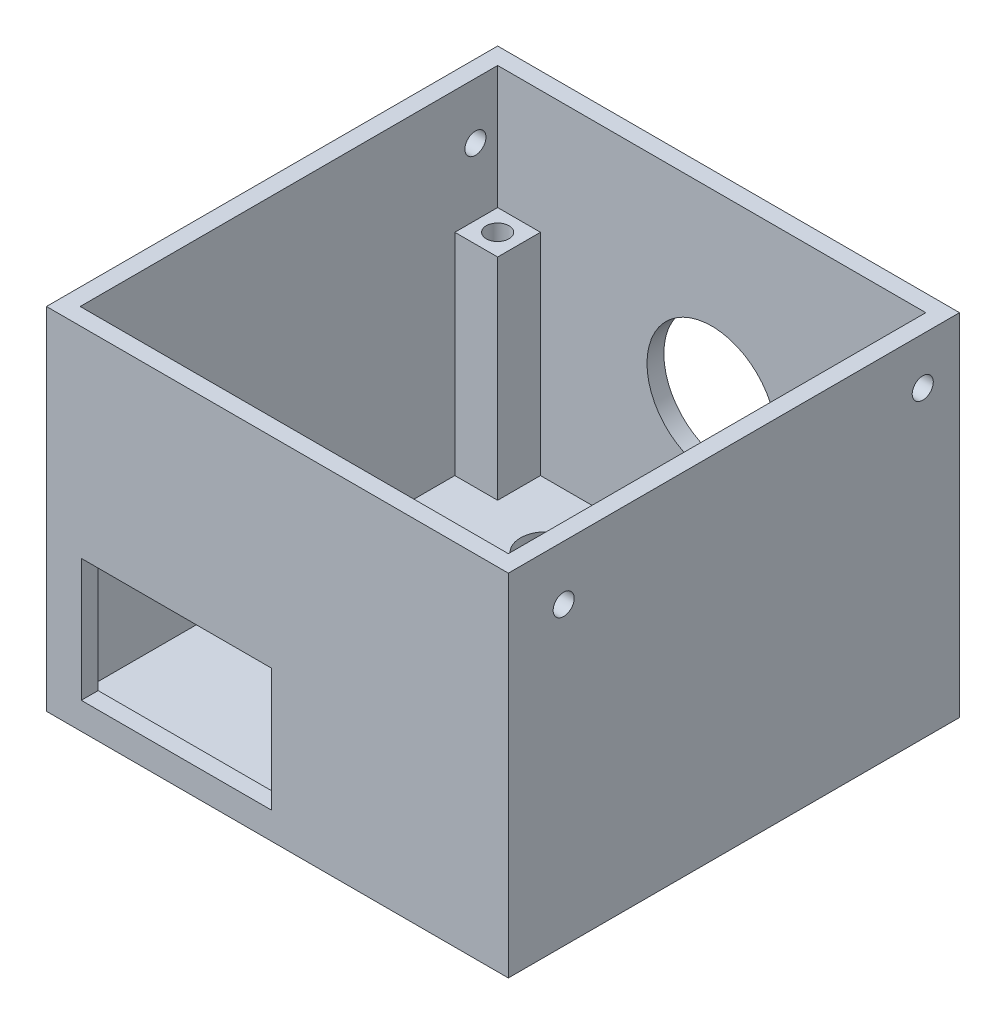
from build123d import *

# Parameters (mm, degrees)
SKETCH1_W           = 54.8
SKETCH1_H           = 53.53
BOSS_EXTRUDE1_DEPTH = 41.6
SKETCH2_W           = 50.8
SKETCH2_H           = 49.53
CUT_EXTRUDE1_DEPTH  = 39.6
SKETCH3_W           = 5.08
SKETCH3_H           = 5.08
BOSS_EXTRUDE2_DEPTH = 25
SKETCH4_R           = 1.35
CUT_EXTRUDE2_DEPTH  = 10
CUT_EXTRUDE3_REACH  = 58.548
SKETCH5_R           = 3
CUT_EXTRUDE4_REACH  = 58.548
SKETCH6_R           = 2
CUT_EXTRUDE5_REACH  = 58.548
SKETCH7_R           = 2
CUT_EXTRUDE6_REACH  = 75.824
SKETCH8_R           = 1.25
CUT_EXTRUDE7_REACH  = 75.824
SKETCH10_R          = 1.25
CUT_EXTRUDE8_REACH  = 75.122
SKETCH12_R          = 7.680495542
CUT_EXTRUDE9_REACH  = 75.122
SKETCH13_W          = 22.581735489
SKETCH13_H          = 14.589690318
CUT_EXTRUDE10_REACH = 75.824
SKETCH14_R          = 1.25


with BuildPart() as part:
    # Sketch1 → Boss-Extrude1 (new body)
    with BuildSketch(Plane(origin=(0, 0, 0), x_dir=(1, 0, 0), z_dir=(0, 1, 0))):
        Rectangle(SKETCH1_W, SKETCH1_H)
    extrude(amount=BOSS_EXTRUDE1_DEPTH)

    # Sketch2 → Cut-Extrude1 (cut)
    with BuildSketch(Plane(origin=(0, 41.6, 0), x_dir=(1, 0, 0), z_dir=(0, 1, 0))):
        Rectangle(SKETCH2_W, SKETCH2_H)
    extrude(amount=-CUT_EXTRUDE1_DEPTH, mode=Mode.SUBTRACT)

    # Sketch3 → Boss-Extrude2 (add)
    with BuildSketch(Plane(origin=(0, 2, 0), x_dir=(1, 0, 0), z_dir=(0, 1, 0))):
        with Locations((-22.86, 22.225)):
            Rectangle(SKETCH3_W, SKETCH3_H)
        with Locations((22.86, 22.225)):
            Rectangle(SKETCH3_W, SKETCH3_H)
        with Locations((22.86, -22.225)):
            Rectangle(SKETCH3_W, SKETCH3_H)
    extrude(amount=BOSS_EXTRUDE2_DEPTH)

    # Sketch4 → Cut-Extrude2 (cut)
    with BuildSketch(Plane(origin=(0, 27, 0), x_dir=(1, 0, 0), z_dir=(0, 1, 0))):
        with Locations((-22.86, 22.225)):
            Circle(SKETCH4_R)
        with Locations((22.86, 22.225)):
            Circle(SKETCH4_R)
        with Locations((22.86, -22.225)):
            Circle(SKETCH4_R)
    extrude(amount=-CUT_EXTRUDE2_DEPTH, mode=Mode.SUBTRACT)

    # Sketch5 → Cut-Extrude3 (cut, up to next)
    with BuildSketch(Plane(origin=(0, 0, 0), x_dir=(-1, 0, 0), z_dir=(0, -1, 0)), mode=Mode.PRIVATE) as cut_extrude3_sk1:
        with Locations((-12.762863618, 17.186859774)):
            Circle(SKETCH5_R)
    cut_extrude3_tool1 = extrude(cut_extrude3_sk1.sketch, amount=-CUT_EXTRUDE3_REACH, mode=Mode.PRIVATE) & part.part
    # Sketch5 → Cut-Extrude3 (cut, up to next)
    with BuildSketch(Plane(origin=(0, 0, 0), x_dir=(-1, 0, 0), z_dir=(0, -1, 0)), mode=Mode.PRIVATE) as cut_extrude3_sk2:
        with Locations((12.108357792, 17.186859774)):
            Circle(SKETCH5_R)
    cut_extrude3_tool2 = extrude(cut_extrude3_sk2.sketch, amount=-CUT_EXTRUDE3_REACH, mode=Mode.PRIVATE) & part.part
    add(cut_extrude3_tool1.solids().sort_by_distance((12.762864, 0, -17.18686))[0], mode=Mode.SUBTRACT)
    add(cut_extrude3_tool2.solids().sort_by_distance((-12.108358, 0, -17.18686))[0], mode=Mode.SUBTRACT)

    # Sketch6 → Cut-Extrude4 (cut, up to next)
    with BuildSketch(Plane(origin=(0, 0, 0), x_dir=(-1, 0, 0), z_dir=(0, -1, 0)), mode=Mode.PRIVATE) as cut_extrude4_sk1:
        with Locations((-16.764285658, 3.623143307)):
            Circle(SKETCH6_R)
    cut_extrude4_tool1 = extrude(cut_extrude4_sk1.sketch, amount=-CUT_EXTRUDE4_REACH, mode=Mode.PRIVATE) & part.part
    # Sketch6 → Cut-Extrude4 (cut, up to next)
    with BuildSketch(Plane(origin=(0, 0, 0), x_dir=(-1, 0, 0), z_dir=(0, -1, 0)), mode=Mode.PRIVATE) as cut_extrude4_sk2:
        with Locations((-16.764285658, -2.073626677)):
            Circle(SKETCH6_R)
    cut_extrude4_tool2 = extrude(cut_extrude4_sk2.sketch, amount=-CUT_EXTRUDE4_REACH, mode=Mode.PRIVATE) & part.part
    add(cut_extrude4_tool1.solids().sort_by_distance((16.764286, 0, -3.623143))[0], mode=Mode.SUBTRACT)
    add(cut_extrude4_tool2.solids().sort_by_distance((16.764286, 0, 2.073627))[0], mode=Mode.SUBTRACT)

    # Sketch7 → Cut-Extrude5 (cut, up to next)
    with BuildSketch(Plane(origin=(0, 0, 0), x_dir=(-1, 0, 0), z_dir=(0, -1, 0)), mode=Mode.PRIVATE) as cut_extrude5_sk1:
        with Locations((-16.67782341, -12.007632718)):
            Circle(SKETCH7_R)
    cut_extrude5_tool1 = extrude(cut_extrude5_sk1.sketch, amount=-CUT_EXTRUDE5_REACH, mode=Mode.PRIVATE) & part.part
    add(cut_extrude5_tool1.solids().sort_by_distance((16.677823, 0, 12.007633))[0], mode=Mode.SUBTRACT)

    # Sketch8 → Cut-Extrude6 (cut, up to next)
    with BuildSketch(Plane(origin=(27.4, 0, 0), x_dir=(0, 0, -1), z_dir=(1, 0, 0)), mode=Mode.PRIVATE) as cut_extrude6_sk1:
        with Locations((-20.200858991, 35.113292919)):
            Circle(SKETCH8_R)
    cut_extrude6_tool1 = extrude(cut_extrude6_sk1.sketch, amount=-CUT_EXTRUDE6_REACH, mode=Mode.PRIVATE) & part.part
    add(cut_extrude6_tool1.solids().sort_by_distance((27.4, 35.113293, 20.200859))[0], mode=Mode.SUBTRACT)

    # Sketch10 → Cut-Extrude7 (cut, up to next)
    with BuildSketch(Plane.ZY.offset(27.4), mode=Mode.PRIVATE) as cut_extrude7_sk1:
        with Locations((-22.126795963, 34.935427745)):
            Circle(SKETCH10_R)
    cut_extrude7_tool1 = extrude(cut_extrude7_sk1.sketch, amount=-CUT_EXTRUDE7_REACH, mode=Mode.PRIVATE) & part.part
    add(cut_extrude7_tool1.solids().sort_by_distance((-27.4, 34.935428, -22.126796))[0], mode=Mode.SUBTRACT)

    # Sketch12 → Cut-Extrude8 (cut, up to next)
    with BuildSketch(Plane(origin=(0, 0, -26.765), x_dir=(-1, 0, 0), z_dir=(0, 0, -1)), mode=Mode.PRIVATE) as cut_extrude8_sk1:
        with Locations((0, 19.850785186)):
            Circle(SKETCH12_R)
    cut_extrude8_tool1 = extrude(cut_extrude8_sk1.sketch, amount=-CUT_EXTRUDE8_REACH, mode=Mode.PRIVATE) & part.part
    add(cut_extrude8_tool1.solids().sort_by_distance((0, 19.850785, -26.765))[0], mode=Mode.SUBTRACT)

    # Sketch13 → Cut-Extrude9 (cut, up to next)
    with BuildSketch(Plane.XY.offset(26.765), mode=Mode.PRIVATE) as cut_extrude9_sk1:
        with Locations((-11.980612505, 10.491224969)):
            Rectangle(SKETCH13_W, SKETCH13_H)
    cut_extrude9_tool1 = extrude(cut_extrude9_sk1.sketch, amount=-CUT_EXTRUDE9_REACH, mode=Mode.PRIVATE) & part.part
    add(cut_extrude9_tool1.solids().sort_by_distance((-11.980613, 10.491225, 26.765))[0], mode=Mode.SUBTRACT)

    # Sketch14 → Cut-Extrude10 (cut, up to next)
    with BuildSketch(Plane(origin=(27.4, 0, 0), x_dir=(0, 0, -1), z_dir=(1, 0, 0)), mode=Mode.PRIVATE) as cut_extrude10_sk1:
        with Locations((22.403153775, 36.040667921)):
            Circle(SKETCH14_R)
    cut_extrude10_tool1 = extrude(cut_extrude10_sk1.sketch, amount=-CUT_EXTRUDE10_REACH, mode=Mode.PRIVATE) & part.part
    add(cut_extrude10_tool1.solids().sort_by_distance((27.4, 36.040668, -22.403154))[0], mode=Mode.SUBTRACT)


solid = part.part
